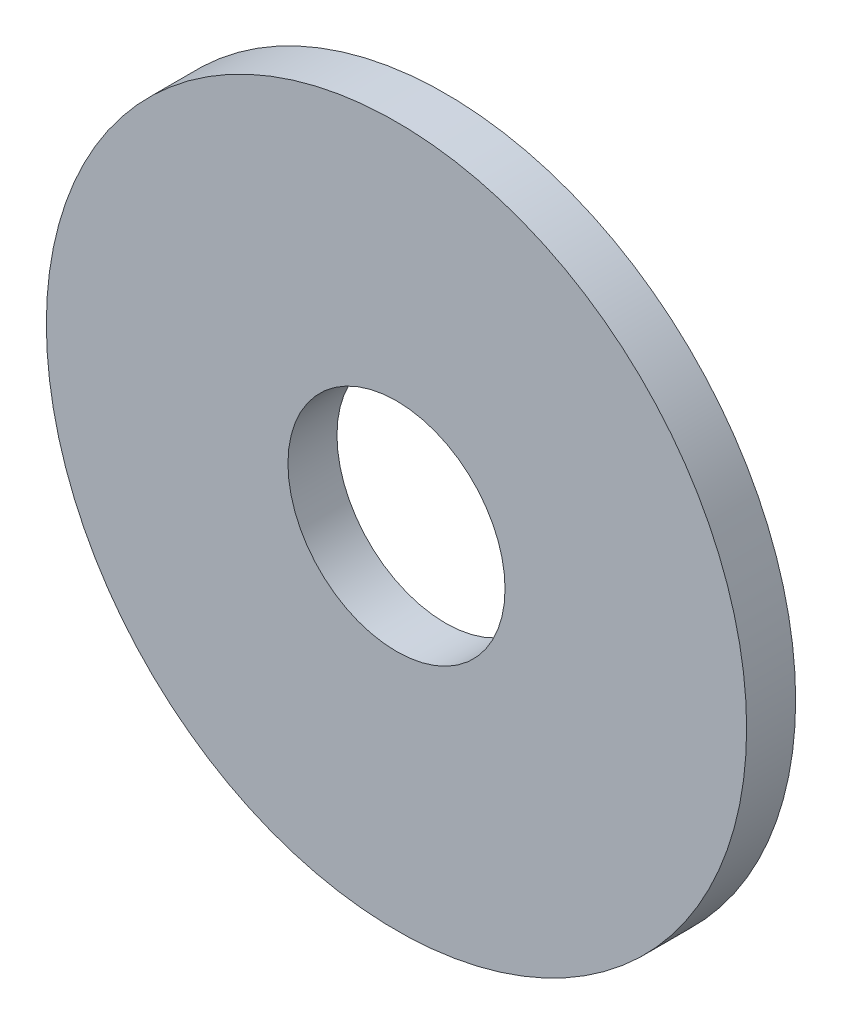
from build123d import *

# Parameters (mm, degrees)
SKETCH1_R           = 15
SKETCH1_R_2         = 4.65
BOSS_EXTRUDE1_DEPTH = 2.1


with BuildPart() as part:
    # Sketch1 → Boss-Extrude1 (new body)
    with BuildSketch(Plane.XY):
        Circle(SKETCH1_R)
        Circle(SKETCH1_R_2, mode=Mode.SUBTRACT)
    extrude(amount=BOSS_EXTRUDE1_DEPTH)


solid = part.part
